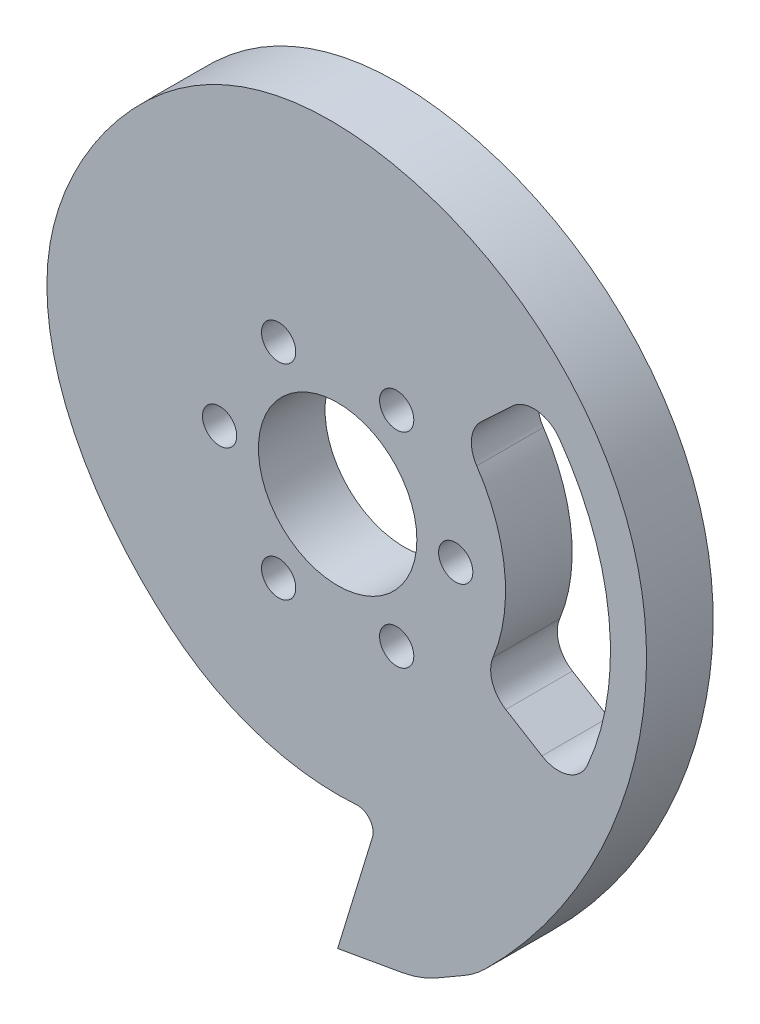
from build123d import *
from OCP.BRepFilletAPI import BRepFilletAPI_MakeFillet

# Parameters (mm, degrees)
SKETCH1_R                   = 15.1
BOSS_EXTRUDE1_DEPTH         = 12.7
FILLET1_R1                  = 3
FILLET1_R2                  = 20
CUT_EXTRUDE1_DEPTH          = 97.187316036
FILLET2_R                   = 6
F_1_4_CLEARANCE_HOLE1_D     = 6.5278
F_1_4_CLEARANCE_HOLE1_DEPTH = 54.11
F_1_4_CLEARANCE_HOLE1_TIP   = 1.961148974


with BuildPart() as part:
    # Sketch1 → Boss-Extrude1 (new body)
    with BuildSketch(Plane.XY):
        with BuildLine():
            ThreePointArc((-31.88226544, -37.995804379), (-13.155899314, -47.823449407), (7.962221644, -48.956746486))
            Line((7.962221644, -48.956746486), (0, -75))
            Line((0, -75), (15.756924048, -72.221629157))
            Line((15.756924048, -72.221629157), (26.149228894, -66.221629157))
            add(Edge.make_bspline(
                [(26.149228894, -66.221629157), (51.375242172, -42.5711118), (73.155327324, 16.265957691), (24.786084456, 64.170295229), (-29.726149903, 61.426673461), (-65.053373901, 8.823513537), (-48.308937171, -24.212190188), (-31.88226544, -37.995804379)],
                knots=[0, 0, 0, 0, 0.320521396, 0.565793749, 0.734822836, 0.843782163, 1, 1, 1, 1], degree=3))
        make_face()
        Circle(SKETCH1_R, mode=Mode.SUBTRACT)
    extrude(amount=BOSS_EXTRUDE1_DEPTH)

    # Fillet1: one fillet with a radius per group of edges: ONE call of the kernel's fillet builder (fillet() takes one radius for all edges)
    fillet1_edges_1 = [part.edges().sort_by_distance(p)[0] for p in [
        (7.962221644, -48.956746486, 6.35),
    ]]
    fillet1_edges_2 = [part.edges().sort_by_distance(p)[0] for p in [
        (15.756924048, -72.221629157, 6.35),
        (26.149228894, -66.221629157, 6.35),
    ]]
    fillet1 = BRepFilletAPI_MakeFillet(part.part.solid().wrapped)
    for e in fillet1_edges_1:
        fillet1.Add(FILLET1_R1, e.wrapped)
    for e in fillet1_edges_2:
        fillet1.Add(FILLET1_R2, e.wrapped)
    add(Compound.cast(fillet1.Shape()), mode=Mode.REPLACE)

    # Sketch2 → Cut-Extrude1 (cut, through all)
    with BuildSketch(Plane.XY.offset(12.7)):
        with BuildLine():
            Line((37.942080132, 35.558382348), (23.348972389, 21.882081445))
            ThreePointArc((23.348972389, 21.882081445), (31.830921123, 3.285188036), (27.325981525, -16.652048935))
            Line((27.325981525, -16.652048935), (44.404719977, -27.059579519))
            ThreePointArc((44.404719977, -27.059579519), (51.725246826, 5.338430558), (37.942080132, 35.558382348))
        make_face()
    extrude(amount=-CUT_EXTRUDE1_DEPTH, mode=Mode.SUBTRACT)

    # Fillet2
    fillet2_edges = [part.edges().sort_by_distance(p)[0] for p in [
        (27.325981525, -16.652048935, 6.35),
        (37.942080132, 35.558382348, 6.35),
        (44.404719977, -27.059579519, 6.35),
        (23.348972389, 21.882081445, 6.35),
    ]]
    fillet(fillet2_edges, radius=FILLET2_R)

    # 1/4 Clearance Hole1
    with Locations(Plane.XY.offset(12.7)):
        with Locations((22.5, 0), (11.25, -19.485571585), (-11.25, -19.485571585), (-22.5, 0), (-11.25, 19.485571585), (11.25, 19.485571585)):
            Hole(F_1_4_CLEARANCE_HOLE1_D / 2, depth=F_1_4_CLEARANCE_HOLE1_DEPTH)
            with Locations((0, 0, -(F_1_4_CLEARANCE_HOLE1_DEPTH + F_1_4_CLEARANCE_HOLE1_TIP / 2))):  # 118° drill point
                Cone(0, F_1_4_CLEARANCE_HOLE1_D / 2, F_1_4_CLEARANCE_HOLE1_TIP, mode=Mode.SUBTRACT)


solid = part.part
